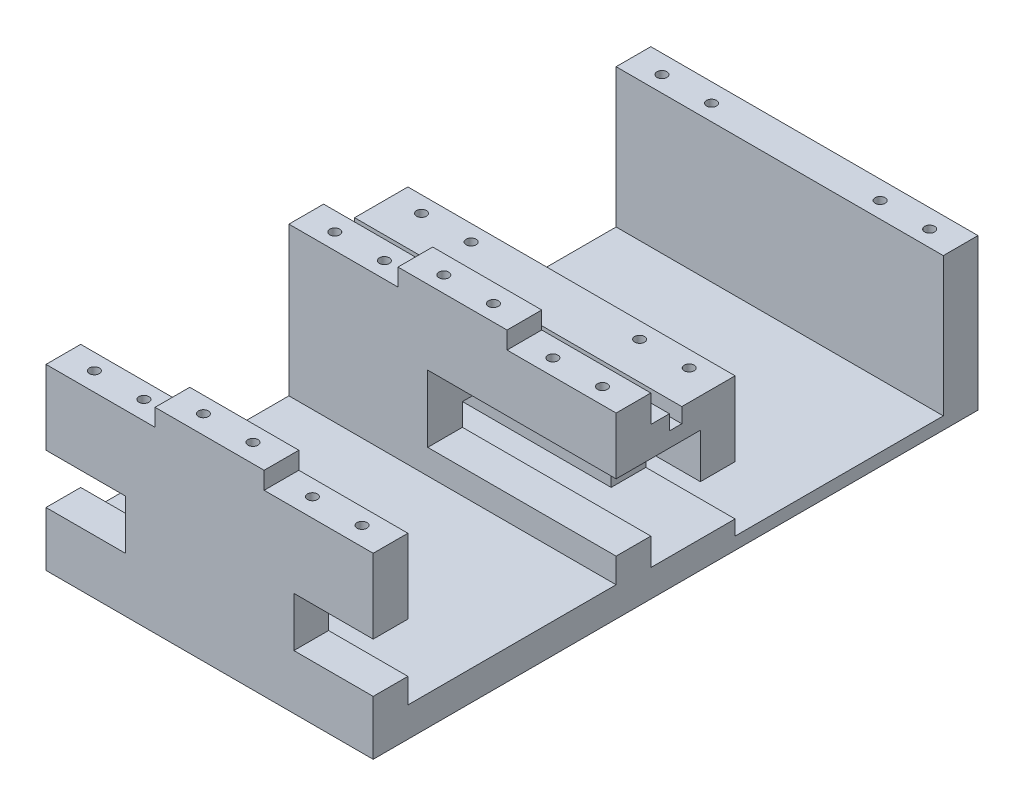
from build123d import *

# Parameters (mm, degrees)
SKETCH1_W            = 66
SKETCH1_H            = 56
BOSS_EXTRUDE1_DEPTH  = 6
SKETCH2_W            = 66
SKETCH2_H            = 7
BOSS_EXTRUDE2_DEPTH  = 30
SKETCH4_W            = 22
SKETCH4_H            = 7
BOSS_EXTRUDE3_DEPTH  = 3.5
SKETCH6_R            = 1
CUT_EXTRUDE1_DEPTH   = 10
SKETCH15_W           = 66
SKETCH15_H           = 66
BOSS_EXTRUDE4_DEPTH  = 2.5
SKETCH16_W           = 66
SKETCH16_H           = 7
BOSS_EXTRUDE6_DEPTH  = 28
SKETCH17_R           = 1
CUT_EXTRUDE2_DEPTH   = 10
CUT_EXTRUDE3_REACH   = 140.352
SKETCH14_W           = 16
SKETCH14_H           = 10
CUT_EXTRUDE4_REACH   = 108.044
SKETCH19_W           = 18
SKETCH19_H           = 10
SKETCH24_W           = 66
SKETCH24_H           = 15
BOSS_EXTRUDE9_DEPTH  = 10
SKETCH27_W           = 38
SKETCH27_H           = 13.5
CUT_EXTRUDE9_DEPTH   = 17
SKETCH26_W           = 66
SKETCH26_H           = 3
BOSS_EXTRUDE10_DEPTH = 10
SKETCH28_W           = 66
SKETCH28_H           = 2.5
CUT_EXTRUDE10_DEPTH  = 3


with BuildPart() as part:
    # Sketch1 → Boss-Extrude1 (new body)
    with BuildSketch(Plane(origin=(0, 0, 0), x_dir=(1, 0, 0), z_dir=(0, 1, 0))):
        with Locations((33, 28)):
            Rectangle(SKETCH1_W, SKETCH1_H)
    boss_extrude1 = extrude(amount=BOSS_EXTRUDE1_DEPTH)

    # Sketch2 → Boss-Extrude2 (add)
    with BuildSketch(Plane(origin=(0, 6, 0), x_dir=(1, 0, 0), z_dir=(0, 1, 0))):
        with Locations((33, 52.5)):
            Rectangle(SKETCH2_W, SKETCH2_H)
    boss_extrude2 = extrude(amount=BOSS_EXTRUDE2_DEPTH)

    # Sketch4 → Boss-Extrude3 (add)
    with BuildSketch(Plane(origin=(0, 36, 0), x_dir=(1, 0, 0), z_dir=(0, 1, 0))):
        with Locations((33, 52.5)):
            Rectangle(SKETCH4_W, SKETCH4_H)
    boss_extrude3 = extrude(amount=BOSS_EXTRUDE3_DEPTH)

    # Sketch6 → Cut-Extrude1 (cut, symmetric)
    with BuildSketch(Plane(origin=(0, 36, 0), x_dir=(1, 0, 0), z_dir=(0, 1, 0))):
        with Locations((6, 52.25)):
            Circle(SKETCH6_R)
        with Locations((16, 52.25)):
            Circle(SKETCH6_R)
        with Locations((38, 52.25)):
            Circle(SKETCH6_R)
        with Locations((28, 52.25)):
            Circle(SKETCH6_R)
        with Locations((60, 52.25)):
            Circle(SKETCH6_R)
        with Locations((50, 52.25)):
            Circle(SKETCH6_R)
    cut_extrude1 = extrude(amount=CUT_EXTRUDE1_DEPTH, both=True, mode=Mode.SUBTRACT)

    # Mirror1: Boss-Extrude1, Boss-Extrude2, Boss-Extrude3, Cut-Extrude1 across plane
    add(boss_extrude1.mirror(Plane.XY.offset(-28)))
    add(boss_extrude2.mirror(Plane.XY.offset(-28)))
    add(boss_extrude3.mirror(Plane.XY.offset(-28)))
    add(cut_extrude1.mirror(Plane.XY.offset(-28)), mode=Mode.SUBTRACT)

    # Sketch15 → Boss-Extrude4 (add)
    with BuildSketch(Plane(origin=(0, 0, 0), x_dir=(1, 0, 0), z_dir=(0, 1, 0))):
        with Locations((33, 89)):
            Rectangle(SKETCH15_W, SKETCH15_H)
    extrude(amount=BOSS_EXTRUDE4_DEPTH)

    # Sketch16 → Boss-Extrude6 (add)
    with BuildSketch(Plane(origin=(0, 2.5, 0), x_dir=(1, 0, 0), z_dir=(0, 1, 0))):
        with Locations((33, 69.5)):
            Rectangle(SKETCH16_W, SKETCH16_H)
    boss_extrude6 = extrude(amount=BOSS_EXTRUDE6_DEPTH)

    # Sketch17 → Cut-Extrude2 (cut)
    with BuildSketch(Plane(origin=(0, 30.5, 0), x_dir=(1, 0, 0), z_dir=(0, 1, 0))):
        with Locations((6, 69.75)):
            Circle(SKETCH17_R)
        with Locations((16, 69.75)):
            Circle(SKETCH17_R)
        with Locations((50, 69.75)):
            Circle(SKETCH17_R)
        with Locations((60, 69.75)):
            Circle(SKETCH17_R)
    cut_extrude2 = extrude(amount=-CUT_EXTRUDE2_DEPTH, mode=Mode.SUBTRACT)

    # Mirror2: Boss-Extrude6, Cut-Extrude2 across plane
    add(boss_extrude6.mirror(Plane(origin=(0, 0, -94), x_dir=(1, 0, 0), z_dir=(0, 0, -1))))
    add(cut_extrude2.mirror(Plane(origin=(0, 0, -94), x_dir=(1, 0, 0), z_dir=(0, 0, -1))), mode=Mode.SUBTRACT)

    # Sketch14 → Cut-Extrude3 (cut, up to next)
    with BuildSketch(Plane(origin=(0, 0, -7), x_dir=(-1, 0, 0), z_dir=(0, 0, -1)), mode=Mode.PRIVATE) as cut_extrude3_sk1:
        with Locations((-8, 16)):
            Rectangle(SKETCH14_W, SKETCH14_H)
    cut_extrude3_tool1 = extrude(cut_extrude3_sk1.sketch, amount=-CUT_EXTRUDE3_REACH, mode=Mode.PRIVATE) & part.part
    # Sketch14 → Cut-Extrude3 (cut, up to next)
    with BuildSketch(Plane(origin=(0, 0, -7), x_dir=(-1, 0, 0), z_dir=(0, 0, -1)), mode=Mode.PRIVATE) as cut_extrude3_sk2:
        with Locations((-58, 16)):
            Rectangle(SKETCH14_W, SKETCH14_H)
    cut_extrude3_tool2 = extrude(cut_extrude3_sk2.sketch, amount=-CUT_EXTRUDE3_REACH, mode=Mode.PRIVATE) & part.part
    add(cut_extrude3_tool1.solids().sort_by_distance((8, 16, -7))[0], mode=Mode.SUBTRACT)
    add(cut_extrude3_tool2.solids().sort_by_distance((58, 16, -7))[0], mode=Mode.SUBTRACT)

    # Sketch19 → Cut-Extrude4 (cut, up to next)
    with BuildSketch(Plane(origin=(0, 0, -73), x_dir=(-1, 0, 0), z_dir=(0, 0, -1)), mode=Mode.PRIVATE) as cut_extrude4_sk1:
        with Locations((-9, 10.5)):
            Rectangle(SKETCH19_W, SKETCH19_H)
    cut_extrude4_tool1 = extrude(cut_extrude4_sk1.sketch, amount=-CUT_EXTRUDE4_REACH, mode=Mode.PRIVATE) & part.part
    # Sketch19 → Cut-Extrude4 (cut, up to next)
    with BuildSketch(Plane(origin=(0, 0, -73), x_dir=(-1, 0, 0), z_dir=(0, 0, -1)), mode=Mode.PRIVATE) as cut_extrude4_sk2:
        with Locations((-57, 10.5)):
            Rectangle(SKETCH19_W, SKETCH19_H)
    cut_extrude4_tool2 = extrude(cut_extrude4_sk2.sketch, amount=-CUT_EXTRUDE4_REACH, mode=Mode.PRIVATE) & part.part
    add(cut_extrude4_tool1.solids().sort_by_distance((9, 10.5, -73))[0], mode=Mode.SUBTRACT)
    add(cut_extrude4_tool2.solids().sort_by_distance((57, 10.5, -73))[0], mode=Mode.SUBTRACT)

    # Sketch24 → Boss-Extrude9 (add)
    with BuildSketch(Plane.XY.offset(-66)):
        with Locations((33, 23)):
            Rectangle(SKETCH24_W, SKETCH24_H)
    extrude(amount=BOSS_EXTRUDE9_DEPTH)

    # Sketch27 → Cut-Extrude9 (cut)
    with BuildSketch(Plane.XY.offset(-49)):
        with Locations((47, 17.75)):
            Rectangle(SKETCH27_W, SKETCH27_H)
    extrude(amount=-CUT_EXTRUDE9_DEPTH, mode=Mode.SUBTRACT)

    # Sketch26 → Boss-Extrude10 (add)
    with BuildSketch(Plane.XY.offset(-66)):
        with Locations((33, 4)):
            Rectangle(SKETCH26_W, SKETCH26_H)
    extrude(amount=BOSS_EXTRUDE10_DEPTH)

    # Sketch28 → Cut-Extrude10 (cut)
    with BuildSketch(Plane(origin=(0, 30.5, 0), x_dir=(1, 0, 0), z_dir=(0, 1, 0))):
        with Locations((33, 61)):
            Rectangle(SKETCH28_W, SKETCH28_H)
    extrude(amount=-CUT_EXTRUDE10_DEPTH, mode=Mode.SUBTRACT)


solid = part.part
